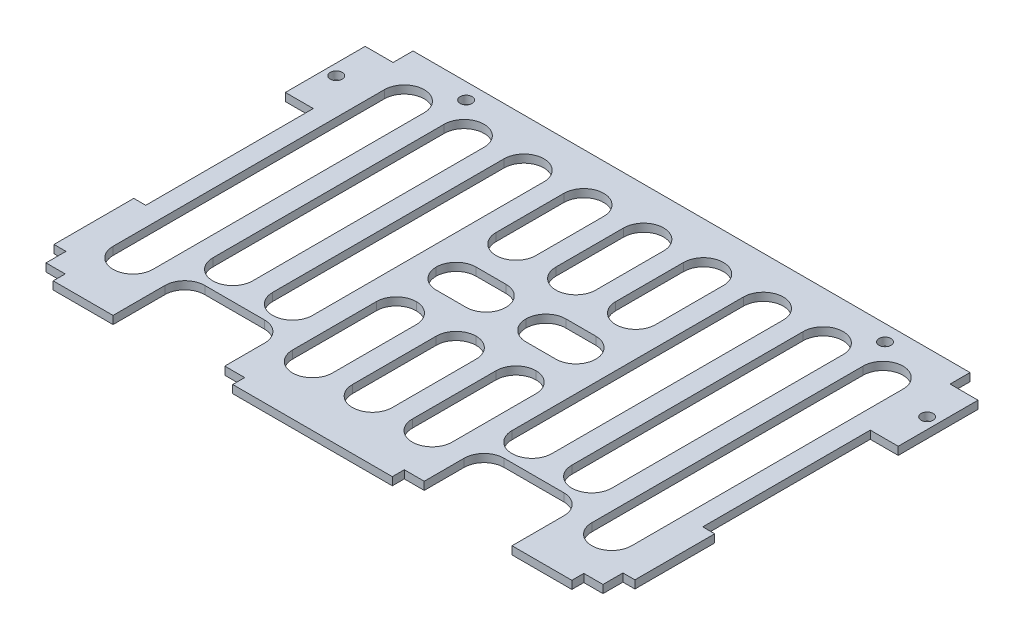
from build123d import *

# Parameters (mm, degrees)
SKETCH_1_W             = 139.61
SKETCH_1_H             = 92
EXTRUDE_1_DEPTH        = 2
SKETCH_2_W             = 40
SKETCH_2_H             = 2
SKETCH_2_W_2           = 15
EXTRUDE_2_DEPTH        = 3
SKETCH_3_W             = 20
SKETCH_3_H             = 2
EXTRUDE_3_DEPTH        = 7
SKETCH_4_R             = 1.5
CUT_EXTRUDE_1_DEPTH    = 92.126330031
CUT_EXTRUDE_2_DEPTH    = 92.126330031
PATTERN_LINEAR_1_COUNT = 9
PATTERN_LINEAR_1_PITCH = 15
SKETCH_8_R             = 1.5
CUT_EXTRUDE_4_DEPTH    = 92.126330031
SKETCH_10_W            = 25
SKETCH_10_H            = 5
EXTRUDE_5_DEPTH        = 2
SKETCH_12_W            = 25
SKETCH_12_H            = 15
CUT_EXTRUDE_5_DEPTH    = 92.126330031
FILLET_1_R             = 5
CUT_EXTRUDE_6_DEPTH    = 92.126330031
EXTRUDE_6_DEPTH        = 2
FILLET_2_R             = 5
SKETCH_15_W            = 3
SKETCH_15_H            = 20
EXTRUDE_7_DEPTH        = 2


with BuildPart() as part:
    # 草图1 → 凸台-拉伸1 (new body)
    with BuildSketch(Plane(origin=(0, 0, 0), x_dir=(1, 0, 0), z_dir=(0, 1, 0))):
        Rectangle(SKETCH_1_W, SKETCH_1_H)
    extrude(amount=EXTRUDE_1_DEPTH)

    # 草图2 → 凸台-拉伸2 (add)
    with BuildSketch(Plane.XY.offset(46)):
        with Locations((0, 1)):
            Rectangle(SKETCH_2_W, SKETCH_2_H)
        with Locations((57.5, 1)):
            Rectangle(SKETCH_2_W_2, SKETCH_2_H)
        with Locations((-57.5, 1)):
            Rectangle(SKETCH_2_W_2, SKETCH_2_H)
    extrude(amount=EXTRUDE_2_DEPTH)

    # 草图3 → 凸台-拉伸3 (add)
    with BuildSketch(Plane(origin=(69.805, 0, 0), x_dir=(0, 0, -1), z_dir=(1, 0, 0))):
        with Locations((31, 1)):
            Rectangle(SKETCH_3_W, SKETCH_3_H)
    extrude_3 = extrude(amount=EXTRUDE_3_DEPTH)

    # 草图4 → 切除-拉伸1 (cut, through all)
    with BuildSketch(Plane(origin=(0, 2, 0), x_dir=(1, 0, 0), z_dir=(0, 1, 0))):
        with Locations(Location((74.055, 31, 0), (0, 0, 270))):
            Circle(SKETCH_4_R)
    cut_extrude_1 = extrude(amount=-CUT_EXTRUDE_1_DEPTH, mode=Mode.SUBTRACT)

    # 草图5 → 切除-拉伸2 (cut, through all)
    with BuildSketch(Plane(origin=(0, 2, 0), x_dir=(1, 0, 0), z_dir=(0, 1, 0))):
        with BuildLine():
            Line((-65, -34), (-65, 34))
            ThreePointArc((-65, 34), (-60, 39), (-55, 34))
            Line((-55, 34), (-55, -34))
            ThreePointArc((-55, -34), (-60, -39), (-65, -34))
        make_face()
    cut_extrude_2 = extrude(amount=-CUT_EXTRUDE_2_DEPTH, mode=Mode.SUBTRACT)

    # 阵列(线性)1: 切除-拉伸2 ×9
    with Locations(*[(i * PATTERN_LINEAR_1_PITCH, 0, 0) for i in range(1, PATTERN_LINEAR_1_COUNT)]):
        add(cut_extrude_2, mode=Mode.SUBTRACT)

    # 草图8 → 切除-拉伸4 (cut, through all)
    with BuildSketch(Plane.XZ):
        with Locations(Location((52.5, -42, 0), (0, 0, 270))):
            Circle(SKETCH_8_R)
    cut_extrude_4 = extrude(amount=-CUT_EXTRUDE_4_DEPTH, mode=Mode.SUBTRACT)

    # 镜向4: 切除-拉伸4 across plane
    add(cut_extrude_4.mirror(Plane(origin=(0, 0, 0), x_dir=(0, 0, 1), z_dir=(1, 0, 0))), mode=Mode.SUBTRACT)

    # 草图10 → 凸台-拉伸5 (add)
    with BuildSketch(Plane(origin=(0, 2, 0), x_dir=(1, 0, 0), z_dir=(0, 1, 0))):
        with Locations((37.5, -31.5)):
            Rectangle(SKETCH_10_W, SKETCH_10_H)
        with Locations((-37.5, -31.5)):
            Rectangle(SKETCH_10_W, SKETCH_10_H)
    extrude(amount=-EXTRUDE_5_DEPTH)

    # 草图12 → 切除-拉伸5 (cut, through all)
    with BuildSketch(Plane(origin=(0, 2, 0), x_dir=(1, 0, 0), z_dir=(0, 1, 0))):
        with Locations((-37.5, -38.5)):
            Rectangle(SKETCH_12_W, SKETCH_12_H)
        with Locations((37.5, -38.5)):
            Rectangle(SKETCH_12_W, SKETCH_12_H)
    extrude(amount=-CUT_EXTRUDE_5_DEPTH, mode=Mode.SUBTRACT)

    # 圆角1
    fillet_1_edges = [part.edges().sort_by_distance(p)[0] for p in [
        (-40, 1, 29),
        (-50, 1, 29),
        (-25, 1, 31),
        (-50, 1, 31),
        (50, 1, 31),
        (25, 1, 31),
        (50, 1, 29),
        (40, 1, 29),
        (35, 1, 29),
        (25, 1, 29),
        (-25, 1, 29),
        (-35, 1, 29),
    ]]
    fillet(fillet_1_edges, radius=FILLET_1_R - 0.0001)  # a hair under: the kernel refuses the full size

    # 草图13 → 切除-拉伸6 (cut, through all)
    with BuildSketch(Plane(origin=(0, 2, 0), x_dir=(1, 0, 0), z_dir=(0, 1, 0))):
        with BuildLine():
            Line((-10, 7), (10, 7))
            ThreePointArc((10, 7), (15, 2), (10, -3))
            Line((10, -3), (-10, -3))
            ThreePointArc((-10, -3), (-15, 2), (-10, 7))
        make_face()
    extrude(amount=-CUT_EXTRUDE_6_DEPTH, mode=Mode.SUBTRACT)

    # 草图14 → 凸台-拉伸6 (add)
    with BuildSketch(Plane(origin=(0, 2, 0), x_dir=(1, 0, 0), z_dir=(0, 1, 0))):
        Polygon((20, 7), (2.5, 7), (2.5, -3), (20, -3), (20, -8), (-20, -8), (-20, -3), (-2.5, -3), (-2.5, 7), (-20, 7), (-20, 12), (20, 12), align=None)
    extrude(amount=-EXTRUDE_6_DEPTH)

    # 圆角2
    fillet_2_edges = [part.edges().sort_by_distance(p)[0] for p in [
        (-10, 1, -12),
        (-20, 1, -12),
        (-5, 1, -12),
        (5, 1, -12),
        (10, 1, -12),
        (20, 1, -12),
        (20, 1, 3),
        (20, 1, -7),
        (20, 1, 8),
        (10, 1, 8),
        (-5, 1, 8),
        (5, 1, 8),
        (-10, 1, 8),
        (-20, 1, 8),
        (2.5, 1, 3),
        (2.5, 1, -7),
        (-2.5, 1, 3),
        (-2.5, 1, -7),
        (-20, 1, 3),
        (-20, 1, -7),
    ]]
    fillet(fillet_2_edges, radius=FILLET_2_R - 0.0001)  # a hair under: the kernel refuses the full size

    # 镜向5: 凸台-拉伸3, 切除-拉伸1 across plane
    add(extrude_3.mirror(Plane(origin=(0, 0, 0), x_dir=(0, 0, 1), z_dir=(1, 0, 0))))
    add(cut_extrude_1.mirror(Plane(origin=(0, 0, 0), x_dir=(0, 0, 1), z_dir=(1, 0, 0))), mode=Mode.SUBTRACT)

    # 草图15 → 凸台-拉伸7 (add)
    with BuildSketch(Plane(origin=(0, 2, 0), x_dir=(1, 0, 0), z_dir=(0, 1, 0))):
        with Locations((71.305, -31)):
            Rectangle(SKETCH_15_W, SKETCH_15_H)
        with Locations((-71.305, -31)):
            Rectangle(SKETCH_15_W, SKETCH_15_H)
    extrude(amount=-EXTRUDE_7_DEPTH)


solid = part.part
